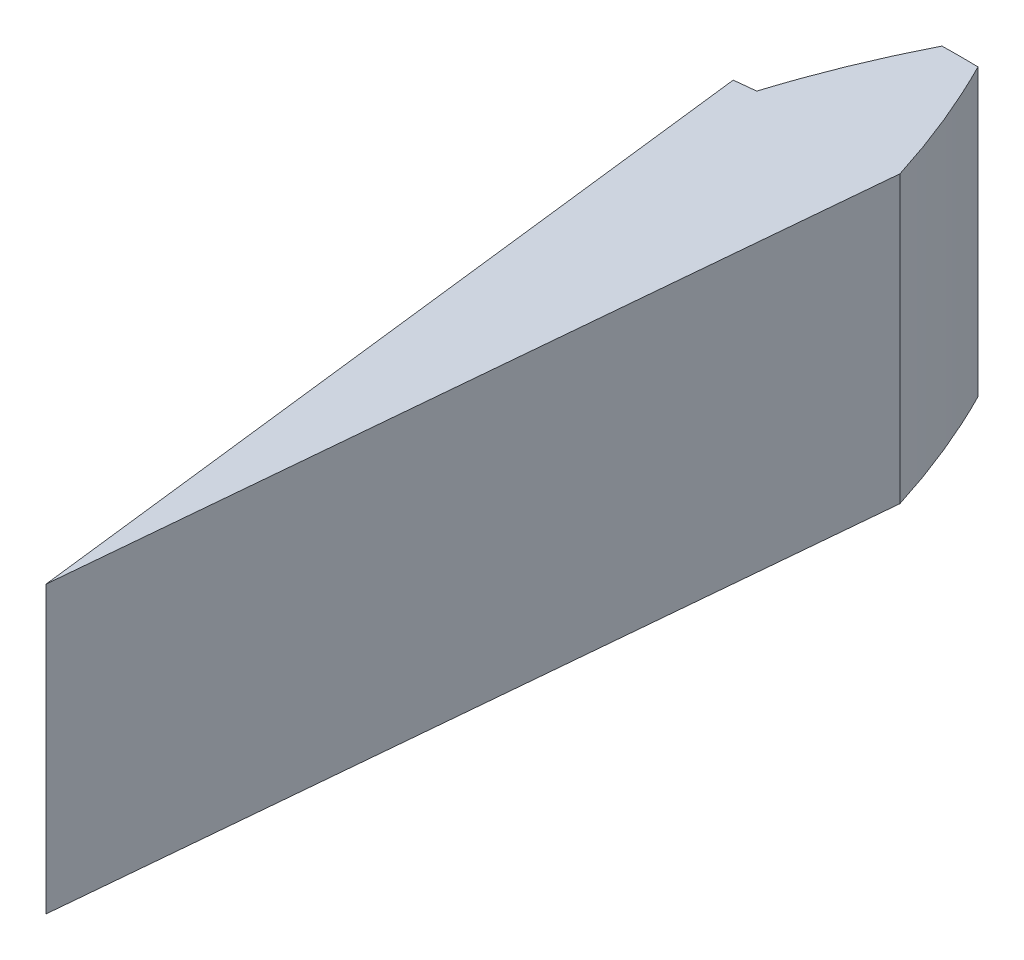
from build123d import *

# Parameters (mm, degrees)
BOSS_EXTRUDE1_DEPTH = 10


with BuildPart() as part:
    # Sketch1 → Boss-Extrude1 (new body)
    with BuildSketch(Plane(origin=(0, 0, 0), x_dir=(1, 0, 0), z_dir=(0, 1, 0))):
        with BuildLine():
            Line((-3.251615928, 27.30708688), (0, 0))
            Line((0, 0), (2.507437516, 27.385447908))
            add(Edge.make_bspline(
                [(2.507437516, 27.385447908), (2.492651354, 27.432676402), (2.463578801, 27.524491099), (2.389878498, 27.755191546), (2.330827647, 27.931248861), (2.245378176, 28.185364452), (2.172960996, 28.39155569), (2.0898446, 28.625689233), (2.010339276, 28.841951085), (1.925875499, 29.067893653), (1.841503531, 29.287094291), (1.754421543, 29.50899127), (1.665922247, 29.728657586), (1.575914556, 29.947710162), (1.483334779, 30.167370188), (1.390697364, 30.383207761), (1.293418605, 30.603936139), (1.199348845, 30.814271978), (1.095386697, 31.039923752), (1.003273461, 31.238101012), (0.88703057, 31.479687303), (0.806386938, 31.646958896), (0.698080505, 31.863578719), (0.654791134, 31.949608843), (0.632399764, 31.993750492)],
                knots=[0.082639144, 0.082639144, 0.082639144, 0.082639144, 0.082639144, 0.122386517, 0.162135305, 0.201884093, 0.24163288, 0.281381668, 0.321130456, 0.360879243, 0.400628031, 0.440376819, 0.480125606, 0.519874394, 0.559623181, 0.599371969, 0.639120757, 0.678869544, 0.718618332, 0.75836712, 0.798115907, 0.837864695, 0.877613483, 0.91736227, 0.91736227, 0.91736227, 0.91736227, 0.91736227], degree=4))
            ThreePointArc((0.632399764, 31.993750492), (0, 32), (-0.632399763, 31.993750492))
            add(Edge.make_bspline(
                [(-0.632399763, 31.993750492), (-0.654791089, 31.94960893), (-0.698080375, 31.863578978), (-0.806386595, 31.646959587), (-0.887030074, 31.479688329), (-1.003272743, 31.238102523), (-1.095385809, 31.039925664), (-1.199347768, 30.814274346), (-1.293417361, 30.603938934), (-1.390695951, 30.383211006), (-1.483333209, 30.167373873), (-1.575912833, 29.947714297), (-1.66592038, 29.72866217), (-1.754419537, 29.508996307), (-1.841501395, 29.287099785), (-1.925873239, 29.0678996), (-2.010336899, 28.841957499), (-2.089842116, 28.625696096), (-2.172958405, 28.391563039), (-2.245375496, 28.185372231), (-2.33082487, 27.93125717), (-2.389875655, 27.755200221), (-2.463575885, 27.524500256), (-2.49264841, 27.432685751), (-2.507437516, 27.385447908)],
                knots=[0.08263773, 0.08263773, 0.08263773, 0.08263773, 0.08263773, 0.122386517, 0.162135305, 0.201884093, 0.24163288, 0.281381668, 0.321130456, 0.360879243, 0.400628031, 0.440376819, 0.480125606, 0.519874394, 0.559623181, 0.599371969, 0.639120757, 0.678869544, 0.718618332, 0.75836712, 0.798115907, 0.837864695, 0.877613483, 0.917362844, 0.917362844, 0.917362844, 0.917362844, 0.917362844], degree=4))
            ThreePointArc((-2.507437516, 27.385447908), (-2.879793266, 27.348798708), (-3.251615928, 27.30708688))
        make_face()
    extrude(amount=BOSS_EXTRUDE1_DEPTH)


solid = part.part
